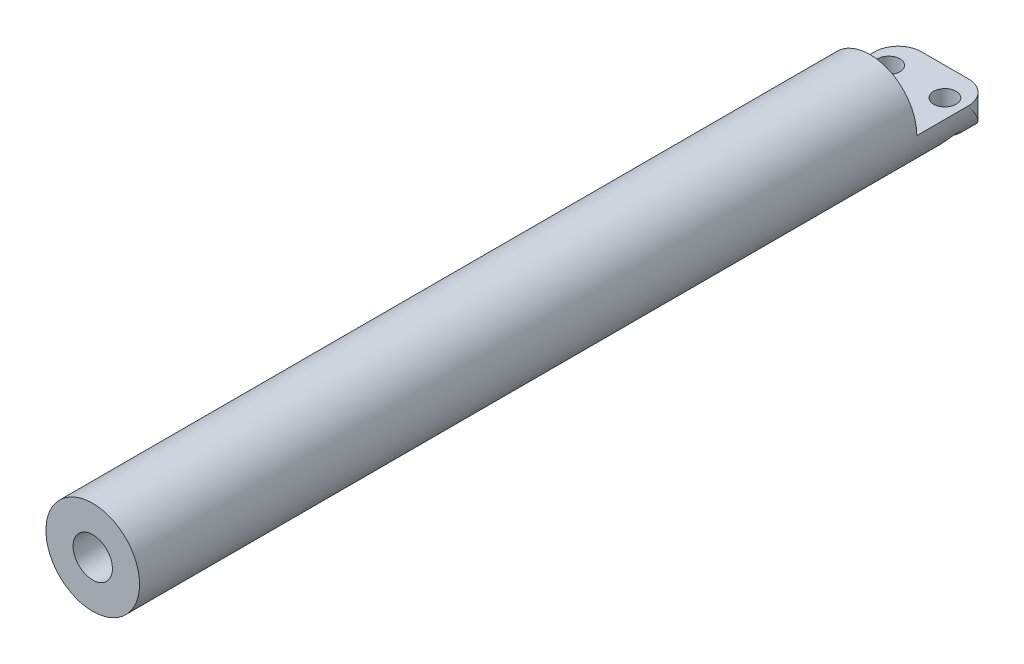
from build123d import *

# Parameters (mm, degrees)
ESBO_O1_R                 = 5
RESSALTO_EXTRUS_O1_DEPTH  = 91
FURO_ROSCADO_DE_M51_D     = 4.2
FURO_ROSCADO_DE_M51_DEPTH = 12.7381927
FURO_ROSCADO_DE_M51_TIP   = 1.2618073
CORTE_EXTRUS_O1_DEPTH     = 8
CORTE_EXTRUS_O2_DEPTH     = 92.27431183
FURO_COM_FOLGA_DE_M21_D   = 2.4


with BuildPart() as part:
    # Esboço1 → Ressalto-extrusão1 (new body)
    with BuildSketch(Plane.XY):
        Circle(ESBO_O1_R)
    extrude(amount=RESSALTO_EXTRUS_O1_DEPTH)

    # Furo roscado de M51
    with Locations(Plane.XY.offset(91)):
        with Locations((0, 0)):
            Hole(FURO_ROSCADO_DE_M51_D / 2, depth=FURO_ROSCADO_DE_M51_DEPTH)
            with Locations((0, 0, -(FURO_ROSCADO_DE_M51_DEPTH + FURO_ROSCADO_DE_M51_TIP / 2))):  # 118° drill point
                Cone(0, FURO_ROSCADO_DE_M51_D / 2, FURO_ROSCADO_DE_M51_TIP, mode=Mode.SUBTRACT)

    # Esboço10 → Corte-extrusão1 (cut)
    with BuildSketch(Plane(origin=(0, 0, 0), x_dir=(-1, 0, 0), z_dir=(0, 0, -1))):
        with BuildLine():
            Line((-5, 0), (5, 0))
            ThreePointArc((5, 0), (0, 5), (-5, 0))
        make_face()
    extrude(amount=-CORTE_EXTRUS_O1_DEPTH, mode=Mode.SUBTRACT)

    # Esboço18 → Corte-extrusão2 (cut, through all)
    with BuildSketch(Plane(origin=(0, 0, 0), x_dir=(1, 0, 0), z_dir=(0, 1, 0))):
        with BuildLine():
            Line((-5, -2.5), (-5, 0))
            Line((-5, 0), (-2.5, 0))
            ThreePointArc((-2.5, 0), (-4.267766953, -0.732233047), (-5, -2.5))
        make_face()
        with BuildLine():
            Line((2.5, 0), (5, 0))
            Line((5, 0), (5, -2.5))
            ThreePointArc((5, -2.5), (4.267766953, -0.732233047), (2.5, 0))
        make_face()
    extrude(amount=-CORTE_EXTRUS_O2_DEPTH, mode=Mode.SUBTRACT)

    # Furo com folga de M21 (through all)
    with Locations(Plane(origin=(-3, 0, 3), x_dir=(0, 0, 1), z_dir=(0, 1, 0))):
        with Locations((0, 0), (0, 6)):
            Hole(FURO_COM_FOLGA_DE_M21_D / 2)


solid = part.part
